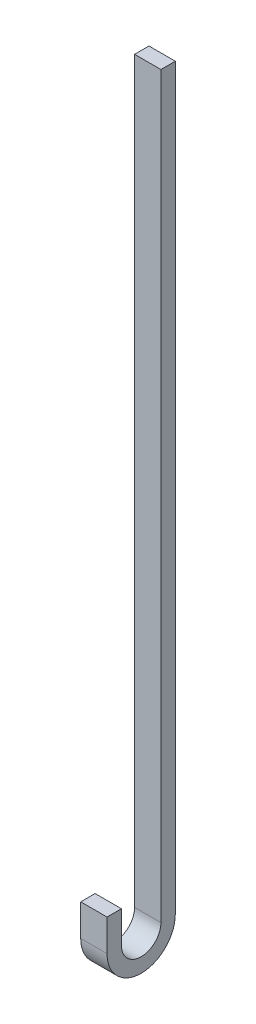
from build123d import *

# Parameters (mm, degrees)
BOSS_EXTRUDE1_DEPTH = 27.432


with BuildPart() as part:
    # Sketch1 → Boss-Extrude1 (new body)
    with BuildSketch(Plane(origin=(0, 0, 0), x_dir=(0, 0, -1), z_dir=(1, 0, 0))):
        with BuildLine():
            Line((0, 0), (0, -33.042482619))
            ThreePointArc((0, -33.042482619), (35.56, -68.602482619), (71.12, -33.042482619))
            Line((71.12, -33.042482619), (71.12, 736.6))
            Line((71.12, 736.6), (56.134, 736.6))
            Line((56.134, 736.6), (56.134, -33.042482619))
            ThreePointArc((56.134, -33.042482619), (35.56, -53.616482619), (14.986, -33.042482619))
            Line((14.986, -33.042482619), (14.986, 0))
            Line((14.986, 0), (0, 0))
        make_face()
    extrude(amount=BOSS_EXTRUDE1_DEPTH)


solid = part.part
